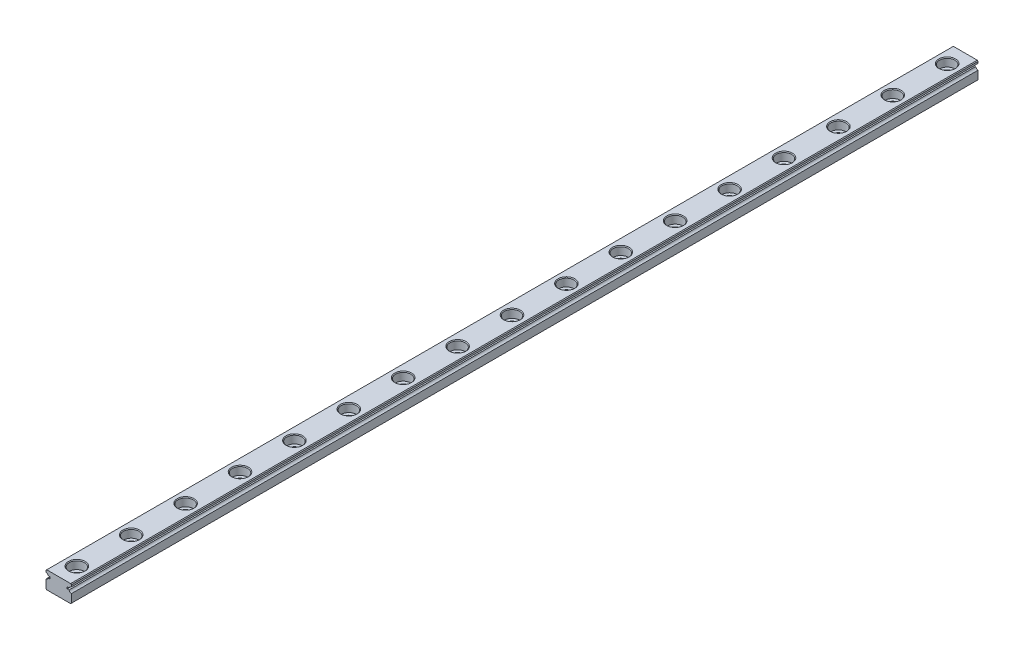
from build123d import *

# Parameters (mm, degrees)
EXTRUDE1_DEPTH             = 250
EXTRUDE2_REACH             = 252.071
SKETCH2_R                  = 1.2
SKETCH_R                   = 2.1
SKETCH_R_2                 = 1.2
EXTRUDE4_DEPTH             = 2.3
CHAMFER1_SIZE              = 0.2
LPATTERN1_COUNT            = 17
LPATTERN1_PITCH            = 15
CHAMFER1_OF_LPATTERN1_SIZE = 0.2


with BuildPart() as part:
    # Sketch1 → Extrude1 (new body)
    with BuildSketch(Plane.XY):
        with BuildLine():
            Line((-3.3, -2.4), (3.3, -2.4))
            Line((3.3, -2.4), (3.5, -2.2))
            Line((3.5, -2.2), (3.5, 0.106274607))
            ThreePointArc((3.5, 0.106274607), (3.091294745, 0.282570681), (2.840065792, 0.65))
            Line((2.840065792, 0.65), (2.340065792, 0.65))
            Line((2.340065792, 0.65), (2.340065792, 1.15))
            Line((2.340065792, 1.15), (2.840065792, 1.15))
            ThreePointArc((2.840065792, 1.15), (3.091294745, 1.517429319), (3.5, 1.693725393))
            Line((3.5, 1.693725393), (3.5, 2.2))
            Line((3.5, 2.2), (3.3, 2.4))
            Line((3.3, 2.4), (-3.3, 2.4))
            Line((-3.3, 2.4), (-3.5, 2.2))
            Line((-3.5, 2.2), (-3.5, 1.693725393))
            ThreePointArc((-3.5, 1.693725393), (-3.091294745, 1.517429319), (-2.840065792, 1.15))
            Line((-2.840065792, 1.15), (-2.340065792, 1.15))
            Line((-2.340065792, 1.15), (-2.340065792, 0.65))
            Line((-2.340065792, 0.65), (-2.840065792, 0.65))
            ThreePointArc((-2.840065792, 0.65), (-3.091294745, 0.282570681), (-3.5, 0.106274607))
            Line((-3.5, 0.106274607), (-3.5, -2.2))
            Line((-3.5, -2.2), (-3.3, -2.4))
        make_face()
    extrude(amount=EXTRUDE1_DEPTH)

    # Sketch2 → Extrude2 (cut, up to next)
    with BuildSketch(Plane(origin=(0, 2.4, 0), x_dir=(1, 0, 0), z_dir=(0, 1, 0)), mode=Mode.PRIVATE) as extrude2_sk1:
        with Locations((0, -5)):
            Circle(SKETCH2_R)
    extrude2_tool1 = extrude(extrude2_sk1.sketch, amount=-EXTRUDE2_REACH, mode=Mode.PRIVATE) & part.part
    extrude2 = extrude2_tool1.solids().sort_by_distance((0, 2.4, 5))[0]
    add(extrude2, mode=Mode.SUBTRACT)

    # Sketch → Extrude4 (cut)
    with BuildSketch(Plane(origin=(0, 2.4, 0), x_dir=(1, 0, 0), z_dir=(0, 1, 0))):
        with Locations((0, -5)):
            Circle(SKETCH_R)
        with Locations((0, -5)):
            Circle(SKETCH_R_2, mode=Mode.SUBTRACT)
    extrude4 = extrude(amount=-EXTRUDE4_DEPTH, mode=Mode.SUBTRACT)

    # Chamfer1
    chamfer1_edges = [part.edges().sort_by_distance(p)[0] for p in [
        (-1.2, -2.4, 5),
        (-2.1, 2.4, 5),
    ]]
    chamfer(chamfer1_edges, length=CHAMFER1_SIZE)

    # LPattern1: Extrude2, Extrude4 ×17
    with Locations(*[(0, 0, i * LPATTERN1_PITCH) for i in range(1, LPATTERN1_COUNT)]):
        add(extrude2, mode=Mode.SUBTRACT)
        add(extrude4, mode=Mode.SUBTRACT)

    # Chamfer1 of LPattern1
    chamfer1_of_lpattern1_edges = [part.edges().sort_by_distance(p)[0] for p in [
        (-1.2, -2.4, 20),
        (-2.1, 2.4, 20),
        (-1.2, -2.4, 35),
        (-2.1, 2.4, 35),
        (-1.2, -2.4, 50),
        (-2.1, 2.4, 50),
        (-1.2, -2.4, 65),
        (-2.1, 2.4, 65),
        (-1.2, -2.4, 80),
        (-2.1, 2.4, 80),
        (-1.2, -2.4, 95),
        (-2.1, 2.4, 95),
        (-1.2, -2.4, 110),
        (-2.1, 2.4, 110),
        (-1.2, -2.4, 125),
        (-2.1, 2.4, 125),
        (-1.2, -2.4, 140),
        (-2.1, 2.4, 140),
        (-1.2, -2.4, 155),
        (-2.1, 2.4, 155),
        (-1.2, -2.4, 170),
        (-2.1, 2.4, 170),
        (-1.2, -2.4, 185),
        (-2.1, 2.4, 185),
        (-1.2, -2.4, 200),
        (-2.1, 2.4, 200),
        (-1.2, -2.4, 215),
        (-2.1, 2.4, 215),
        (-1.2, -2.4, 230),
        (-2.1, 2.4, 230),
        (-1.2, -2.4, 245),
        (-2.1, 2.4, 245),
    ]]
    chamfer(chamfer1_of_lpattern1_edges, length=CHAMFER1_OF_LPATTERN1_SIZE)


solid = part.part
